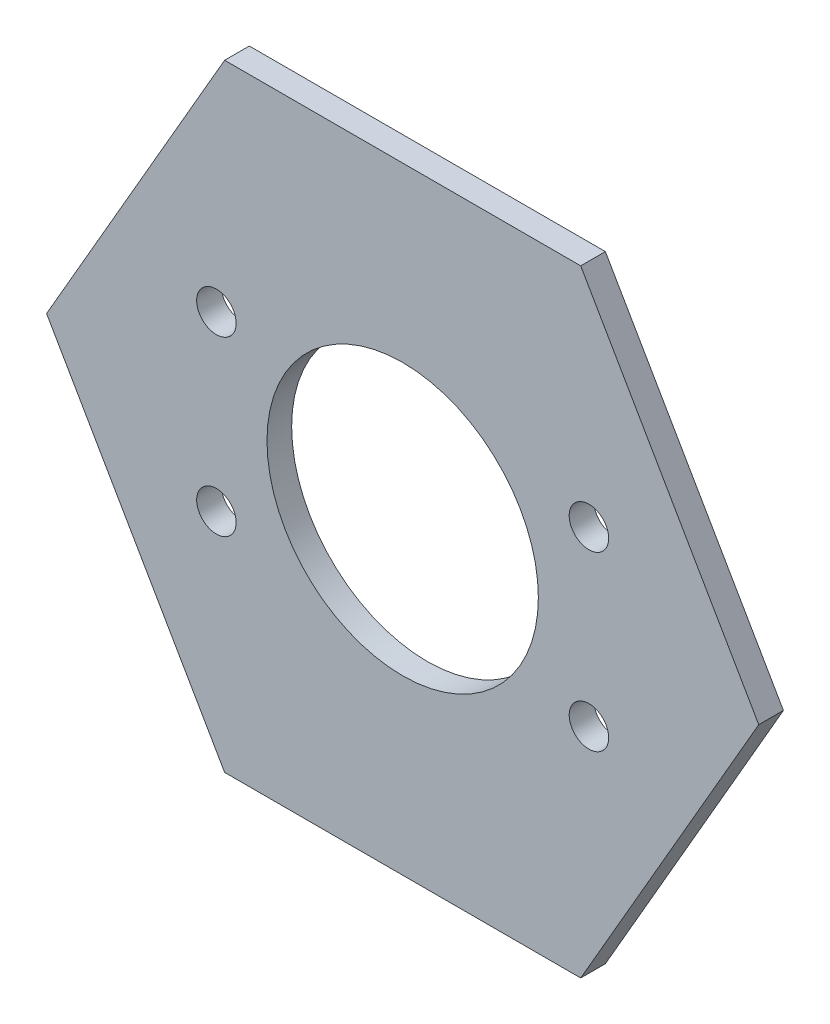
from build123d import *

# Parameters (mm, degrees)
SKETCH1_R           = 11
SKETCH1_R_2         = 1.6
BOSS_EXTRUDE1_DEPTH = 2


with BuildPart() as part:
    # Sketch1 → Boss-Extrude1 (new body)
    with BuildSketch(Plane.XY):
        Polygon((-14.43375673, 25), (14.43375673, 25), (28.867513459, 0), (14.43375673, -25), (-14.43375673, -25), (-28.867513459, 0), align=None)
        Circle(SKETCH1_R, mode=Mode.SUBTRACT)
        with Locations((-15.1, -7)):
            Circle(SKETCH1_R_2, mode=Mode.SUBTRACT)
        with Locations((-15.1, 7)):
            Circle(SKETCH1_R_2, mode=Mode.SUBTRACT)
        with Locations((15.1, 7)):
            Circle(SKETCH1_R_2, mode=Mode.SUBTRACT)
        with Locations((15.1, -7)):
            Circle(SKETCH1_R_2, mode=Mode.SUBTRACT)
    extrude(amount=BOSS_EXTRUDE1_DEPTH)


solid = part.part
